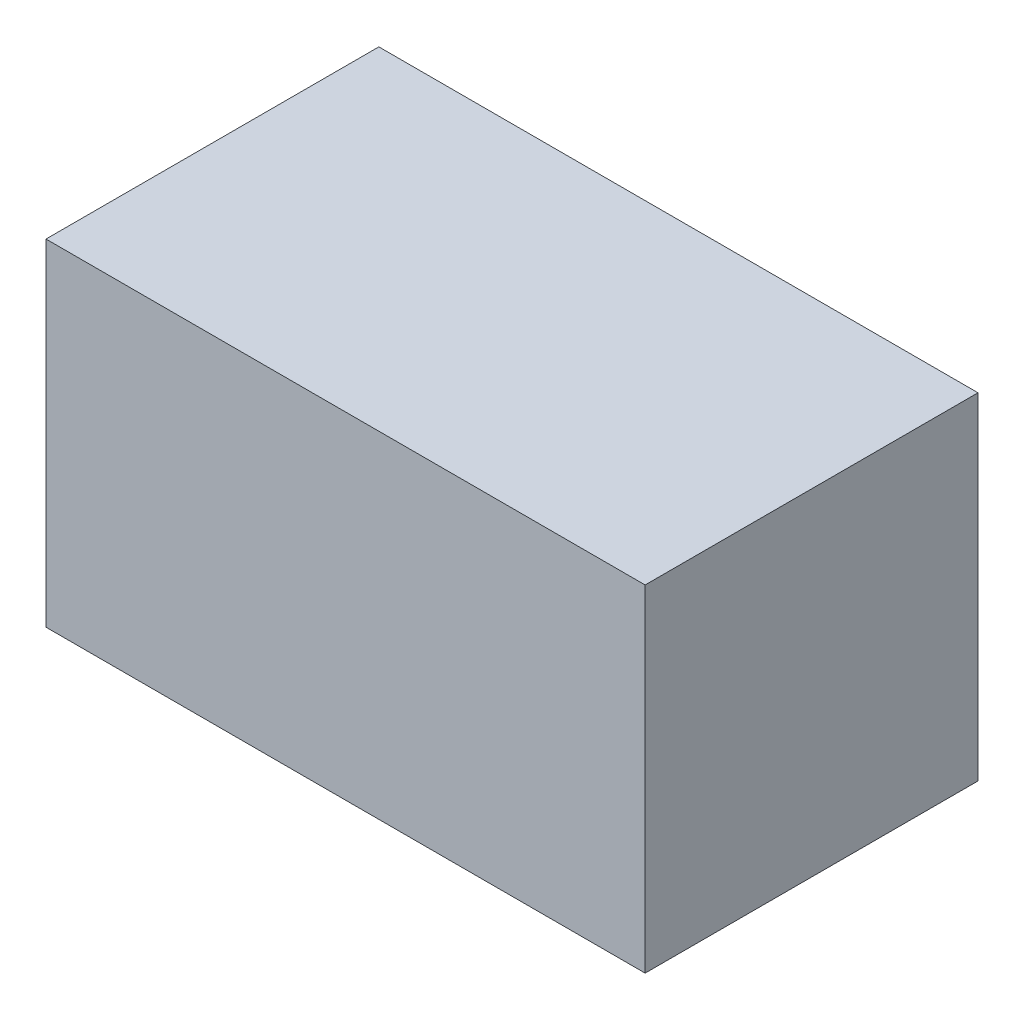
from build123d import *

# Parameters (mm, degrees)
SKETCH1_W           = 54
SKETCH1_H           = 30
BOSS_EXTRUDE1_DEPTH = 30.3


with BuildPart() as part:
    # Sketch1 → Boss-Extrude1 (new body)
    with BuildSketch(Plane(origin=(0, 0, 0), x_dir=(1, 0, 0), z_dir=(0, 1, 0))):
        Rectangle(SKETCH1_W, SKETCH1_H)
    extrude(amount=BOSS_EXTRUDE1_DEPTH)


solid = part.part
